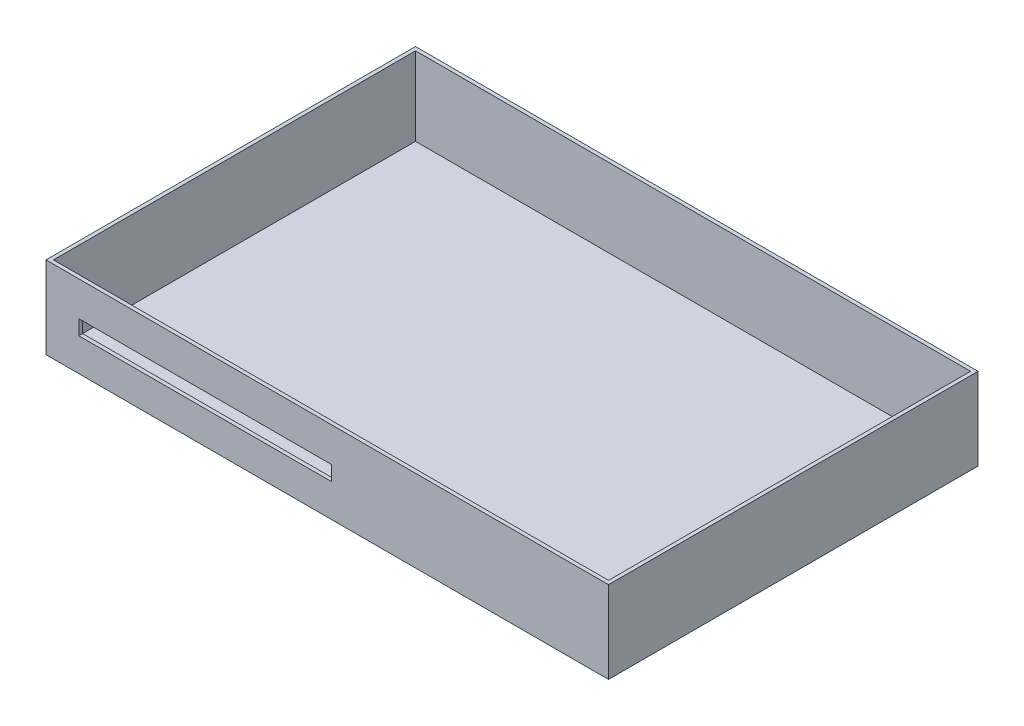
from build123d import *

# Parameters (mm, degrees)
SKETCH1_W           = 1370
SKETCH1_H           = 900
BOSS_EXTRUDE1_DEPTH = 200
SHELL1_T            = -9
CUT_EXTRUDE1_REACH  = 1653.333
SKETCH3_W           = 615
SKETCH3_H           = 36


with BuildPart() as part:
    # Sketch1 → Boss-Extrude1 (new body)
    with BuildSketch(Plane(origin=(0, 0, 0), x_dir=(1, 0, 0), z_dir=(0, 1, 0))):
        with Locations((685, 450)):
            Rectangle(SKETCH1_W, SKETCH1_H)
    extrude(amount=BOSS_EXTRUDE1_DEPTH)

    # Shell1
    shell1_openings = [part.faces().sort_by_distance(p)[0] for p in [
        (685, 200, -450),
    ]]
    offset(amount=SHELL1_T, openings=shell1_openings, kind=Kind.INTERSECTION)

    # Sketch3 → Cut-Extrude1 (cut, up to next)
    with BuildSketch(Plane.XY, mode=Mode.PRIVATE) as cut_extrude1_sk1:
        with Locations((387.5, 98)):
            Rectangle(SKETCH3_W, SKETCH3_H)
    cut_extrude1_tool1 = extrude(cut_extrude1_sk1.sketch, amount=-CUT_EXTRUDE1_REACH, mode=Mode.PRIVATE) & part.part
    add(cut_extrude1_tool1.solids().sort_by_distance((387.5, 98, 0))[0], mode=Mode.SUBTRACT)


solid = part.part
